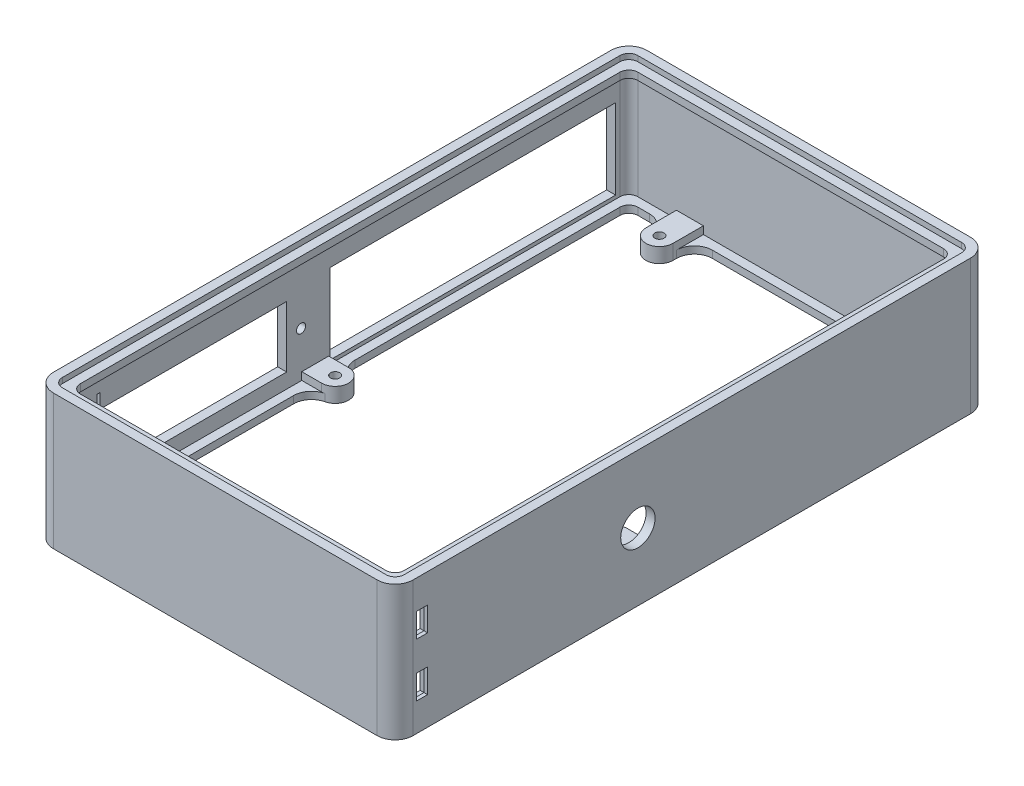
from build123d import *

# Parameters (mm, degrees)
SKETCH1_W            = 200
SKETCH1_H            = 330
BOSS_EXTRUDE1_DEPTH  = 75
FILLET1_R            = 10
CUT_EXTRUDE1_DEPTH   = 75
SKETCH3_W            = 180
SKETCH3_H            = 310
BOSS_EXTRUDE2_DEPTH  = 4
BOSS_EXTRUDE3_START  = -4
SKETCH4_W            = 180
SKETCH4_H            = 310
BOSS_EXTRUDE3_DEPTH  = 4
SKETCH8_W            = 158.75
SKETCH8_H            = 44.5
CUT_EXTRUDE2_DEPTH   = 40
BOSS_EXTRUDE4_START  = -8.23
SKETCH11_R           = 2.55
BOSS_EXTRUDE4_DEPTH  = 8.23
SKETCH12_R           = 2.55
SKETCH12_W           = 101.8
SKETCH12_H           = 34
CUT_EXTRUDE3_DEPTH   = 31.23
SKETCH13_R           = 9.55
CUT_EXTRUDE4_DEPTH   = 31.23
FILLET2_R            = 10
FILLET3_R            = 20
FILLET4_R            = 5
CUT_EXTRUDE5_DEPTH   = 10
SKETCH15_W           = 2
SKETCH15_H           = 47.02140159
BOSS_EXTRUDE5_DEPTH  = 8
SKETCH16_R           = 2.55
CUT_EXTRUDE6_DEPTH   = 2
BOSS_EXTRUDE6_START  = 3
SKETCH17_R           = 4.5
SKETCH17_R_2         = 2.55
BOSS_EXTRUDE6_DEPTH  = 3
CHAMFER1_SIZE        = 3
FILLET5_R            = 5
CHAMFER2_SIZE        = 3
SKETCH19_W           = 7
SKETCH19_H           = 14.5
CUT_EXTRUDE8_DEPTH   = 18
SKETCH22_W           = 7
SKETCH22_H           = 0.375
CUT_EXTRUDE9_DEPTH   = 18
SKETCH23_W           = 7
SKETCH23_H           = 0.375
BOSS_EXTRUDE7_DEPTH  = 5
SKETCH20_R           = 2.55
CUT_EXTRUDE10_DEPTH  = 18
SKETCH24_W           = 8
SKETCH24_H           = 15.5
CUT_EXTRUDE12_DEPTH  = 10
SKETCH25_W           = 8
SKETCH25_H           = 0.4
BOSS_EXTRUDE8_DEPTH  = 5
SKETCH26_W           = 0.1
SKETCH26_H           = 15.1
BOSS_EXTRUDE9_DEPTH  = 5
BOSS_EXTRUDE10_DEPTH = 2
SKETCH28_W           = 12.985784693
SKETCH28_H           = 10.415883014
BOSS_EXTRUDE11_DEPTH = 5
BOSS_EXTRUDE12_START = -0.6
SKETCH29_R           = 2.55
BOSS_EXTRUDE12_DEPTH = 0.6


with BuildPart() as part:
    # Sketch1 → Boss-Extrude1 (new body)
    with BuildSketch(Plane(origin=(0, 0, 0), x_dir=(1, 0, 0), z_dir=(0, 1, 0))):
        with Locations((100, 165)):
            Rectangle(SKETCH1_W, SKETCH1_H)
    extrude(amount=BOSS_EXTRUDE1_DEPTH)

    # Fillet1
    fillet1_edges = [part.edges().sort_by_distance(p)[0] for p in [
        (0, 37.5, -330),
        (200, 37.5, -330),
        (200, 37.5, 0),
        (0, 37.5, 0),
    ]]
    fillet(fillet1_edges, radius=FILLET1_R)

    # Sketch2 → Cut-Extrude1 (cut)
    with BuildSketch(Plane(origin=(0, 75, 0), x_dir=(1, 0, 0), z_dir=(0, 1, 0))):
        with BuildLine():
            Line((190, 325), (10, 325))
            ThreePointArc((10, 325), (6.464466094, 323.535533906), (5, 320))
            Line((5, 320), (5, 10))
            ThreePointArc((5, 10), (6.464466094, 6.464466094), (10, 5))
            Line((10, 5), (190, 5))
            ThreePointArc((190, 5), (193.535533906, 6.464466094), (195, 10))
            Line((195, 10), (195, 320))
            ThreePointArc((195, 320), (193.535533906, 323.535533906), (190, 325))
        make_face()
    extrude(amount=-CUT_EXTRUDE1_DEPTH, mode=Mode.SUBTRACT)

    # Sketch3 → Boss-Extrude2 (add)
    with BuildSketch(Plane(origin=(0, 72, 0), x_dir=(1, 0, 0), z_dir=(0, 1, 0))):
        with BuildLine():
            Line((10, 5), (190, 5))
            ThreePointArc((190, 5), (193.535533906, 6.464466094), (195, 10))
            Line((195, 10), (195, 320))
            ThreePointArc((195, 320), (193.535533906, 323.535533906), (190, 325))
            Line((190, 325), (10, 325))
            ThreePointArc((10, 325), (6.464466094, 323.535533906), (5, 320))
            Line((5, 320), (5, 10))
            ThreePointArc((5, 10), (6.464466094, 6.464466094), (10, 5))
        make_face()
        with Locations((100, 165)):
            Rectangle(SKETCH3_W, SKETCH3_H, mode=Mode.SUBTRACT)
    extrude(amount=-BOSS_EXTRUDE2_DEPTH)

    # Sketch4 → Boss-Extrude3 (add)
    with BuildSketch(Plane(origin=(0, 3, 0), x_dir=(-1, 0, 0), z_dir=(0, -1, 0)).offset(BOSS_EXTRUDE3_START)):
        with BuildLine():
            Line((-5, 10), (-5, 320))
            ThreePointArc((-5, 320), (-6.464466094, 323.535533906), (-10, 325))
            Line((-10, 325), (-190, 325))
            ThreePointArc((-190, 325), (-193.535533906, 323.535533906), (-195, 320))
            Line((-195, 320), (-195, 10))
            ThreePointArc((-195, 10), (-193.535533906, 6.464466094), (-190, 5))
            Line((-190, 5), (-10, 5))
            ThreePointArc((-10, 5), (-6.464466094, 6.464466094), (-5, 10))
        make_face()
        with Locations((-100, 165)):
            Rectangle(SKETCH4_W, SKETCH4_H, mode=Mode.SUBTRACT)
    extrude(amount=BOSS_EXTRUDE3_DEPTH)

    # Sketch8 → Cut-Extrude2 (cut)
    with BuildSketch(Plane(origin=(5, 0, 0), x_dir=(0, 0, -1), z_dir=(1, 0, 0))):
        with Locations((238.245, 31.25)):
            Rectangle(SKETCH8_W, SKETCH8_H)
    extrude(amount=-CUT_EXTRUDE2_DEPTH, mode=Mode.SUBTRACT)

    # Sketch11 → Boss-Extrude4 (add)
    # profile 1 of 4: a face of its own
    with BuildSketch(Plane.XZ.offset(-3).offset(BOSS_EXTRUDE4_START)):
        with BuildLine():
            Line((16.06, -158.09), (10, -158.09))
            Line((10, -158.09), (5, -158.09))
            Line((5, -158.09), (5, -143.09))
            Line((5, -143.09), (10, -143.09))
            Line((10, -143.09), (16.06, -143.09))
            ThreePointArc((16.06, -143.09), (23.56, -150.59), (16.06, -158.09))
        make_face()
        with Locations(Location((16.06, -150.59, 0), (0, 0, 270))):
            Circle(SKETCH11_R, mode=Mode.SUBTRACT)
    # profile 2 of 4: a face of its own
    with BuildSketch(Plane.XZ.offset(-3).offset(BOSS_EXTRUDE4_START)):
        with BuildLine():
            Line((31.42, -308.07), (31.42, -320))
            Line((31.42, -320), (31.42, -325))
            Line((31.42, -325), (46.42, -325))
            Line((46.42, -325), (46.42, -320))
            Line((46.42, -320), (46.42, -308.07))
            ThreePointArc((46.42, -308.07), (38.92, -300.57), (31.42, -308.07))
        make_face()
        with Locations(Location((38.92, -308.07, 0), (0, 0, 270))):
            Circle(SKETCH11_R, mode=Mode.SUBTRACT)
    # profile 3 of 4: a face of its own
    with BuildSketch(Plane.XZ.offset(-3).offset(BOSS_EXTRUDE4_START)):
        with BuildLine():
            Line((171, -300.57), (190, -300.57))
            Line((190, -300.57), (195, -300.57))
            Line((195, -300.57), (195, -320))
            ThreePointArc((195, -320), (193.535533906, -323.535533906), (190, -325))
            Line((190, -325), (163.5, -325))
            Line((163.5, -325), (163.5, -320))
            Line((163.5, -320), (163.5, -308.07))
            ThreePointArc((163.5, -308.07), (165.696699141, -302.766699141), (171, -300.57))
        make_face()
        with Locations(Location((171, -308.07, 0), (0, 0, 270))):
            Circle(SKETCH11_R, mode=Mode.SUBTRACT)
    # profile 4 of 4: a face of its own
    with BuildSketch(Plane.XZ.offset(-3).offset(BOSS_EXTRUDE4_START)):
        with BuildLine():
            Line((171, -158.09), (190, -158.09))
            Line((190, -158.09), (195, -158.09))
            Line((195, -158.09), (195, -143.09))
            Line((195, -143.09), (190, -143.09))
            Line((190, -143.09), (171, -143.09))
            ThreePointArc((171, -143.09), (163.5, -150.59), (171, -158.09))
        make_face()
        with Locations(Location((171, -150.59, 0), (0, 0, 270))):
            Circle(SKETCH11_R, mode=Mode.SUBTRACT)
    extrude(amount=BOSS_EXTRUDE4_DEPTH)

    # Sketch12 → Cut-Extrude3 (cut)
    with BuildSketch(Plane.ZY):
        with Locations((-142.7, 32.25)):
            Circle(SKETCH12_R)
        with Locations((-83.8, 32.25)):
            Rectangle(SKETCH12_W, SKETCH12_H)
    extrude(amount=-CUT_EXTRUDE3_DEPTH, mode=Mode.SUBTRACT)

    # Sketch13 → Cut-Extrude4 (cut)
    with BuildSketch(Plane.ZY.offset(-195)):
        with Locations((-135, 37.5)):
            Circle(SKETCH13_R)
    extrude(amount=-CUT_EXTRUDE4_DEPTH, mode=Mode.SUBTRACT)

    # Fillet2
    # the kernel refuses this fillet: 10 mm, written as the material it adds along each edge
    with BuildSketch(Plane(origin=(31.42, 3, -320), x_dir=(0, 0, 1), z_dir=(0, 1, 0))) as fillet2_piece_1:
        with BuildLine():
            CenterArc((FILLET2_R, -FILLET2_R), FILLET2_R, 90, 90)
            Line((0, -FILLET2_R), (0, 0))
            Line((0, 0), (FILLET2_R, 0))
        make_face()
    extrude(amount=4)
    with BuildSketch(Plane(origin=(46.42, 7, -320), x_dir=(1, 0, 0), z_dir=(0, -1, 0))) as fillet2_piece_2:
        with BuildLine():
            CenterArc((FILLET2_R, FILLET2_R), FILLET2_R, 180, 90)
            Line((0, FILLET2_R), (0, 0))
            Line((0, 0), (FILLET2_R, 0))
        make_face()
    extrude(amount=4)
    with BuildSketch(Plane(origin=(10, 7, -143.09), x_dir=(0.9996913663867205, 0, -0.02484294611859972), z_dir=(0, -1, 0))) as fillet2_piece_3:
        with BuildLine():
            CenterArc((9.759646117, 9.796182659), FILLET2_R, 181.423542417, 76.988721184)
            Line((-0.237267547, 9.547753198), (-1.236958913, 9.522910252))
            Line((-1.236958913, 9.522910252), (-0.999691366, -0.024842946))
            Line((-0.999691366, -0.024842946), (0.024842946, -0.999691366))
            ThreePointArc((0.024842946, -0.999691366), (6.082972626, -0.849143113), (7.550095388, -0.979618266))
            Line((7.550095388, -0.979618266), (7.750963636, 0))
        make_face()
    extrude(amount=4)
    with BuildSketch(Plane(origin=(10, 3, -158.09), x_dir=(0, 0, -1), z_dir=(0, 1, 0))) as fillet2_piece_4:
        with BuildLine():
            CenterArc((9.550700865, -10), FILLET2_R, 90, 76.988721184)
            Line((-0.192556772, -7.748571429), (-1.166882536, -7.523428571))
            ThreePointArc((-1.166882536, -7.523428571), (-1, -6.06), (-1, 0))
            Line((-1, 0), (0, 1))
            Line((0, 1), (9.550700865, 1))
            Line((9.550700865, 1), (9.550700865, 0))
        make_face()
    extrude(amount=4)

    # Fillet3
    # the kernel refuses this fillet: 20 mm, written as the material it adds along each edge
    with BuildSketch(Plane(origin=(190, 7, -143.09), x_dir=(-0.9999999668790588, 0, -0.00025737498219353277), z_dir=(0, -1, 0))) as fillet3_piece_1:
        with BuildLine():
            CenterArc((19.994856519, -19.986959005), FILLET3_R, 92.069195834, 87.916057665)
            Line((-0.005142819, -19.981811506), (-2.005142752, -19.981296756))
            Line((-2.005142752, -19.981296756), (-1.999999934, 0.00051475))
            Line((-1.999999934, 0.00051475), (0.00051475, 1.999999934))
            ThreePointArc((0.00051475, 1.999999934), (19.000514121, 1.995109809), (19.20051505, 1.998695901))
            Line((19.20051505, 1.998695901), (19.272727911, 0))
        make_face()
    extrude(amount=4)
    with BuildSketch(Plane(origin=(190, 3, -158.09), x_dir=(0, 0, -1), z_dir=(0, 1, 0))) as fillet3_piece_2:
        with BuildLine():
            CenterArc((19.981812167, 20), FILLET3_R, 182.083942335, 87.916057665)
            Line((-0.004960318, 19.272727273), (-2.003637567, 19.2))
            ThreePointArc((-2.003637567, 19.2), (-2, 19), (-2, 0))
            Line((-2, 0), (0, -2))
            Line((0, -2), (19.981812167, -2))
            Line((19.981812167, -2), (19.981812167, 0))
        make_face()
    extrude(amount=4)

    # Fillet4
    fillet4_edges = [part.edges().sort_by_distance(p)[0] for p in [
        (10, 5, -320),
        (10, 5, -10),
        (190, 5, -10),
        (10, 70, -10),
        (10, 70, -320),
        (190, 70, -320),
        (190, 70, -10),
    ]]
    fillet(fillet4_edges, radius=FILLET4_R)

    # Sketch14 → Cut-Extrude5 (cut)
    with BuildSketch(Plane.ZY):
        Polygon((-30.9, 49.25), (-30.9, 15.25), (-30.9, 10.25), (-29.15, 10.25), (-29.15, 57.25), (-30.9, 57.25), align=None)
    extrude(amount=-CUT_EXTRUDE5_DEPTH, mode=Mode.SUBTRACT)

    # Sketch15 → Boss-Extrude5 (add)
    with BuildSketch(Plane.ZY):
        with Locations((-31.9, 33.760700795)):
            Rectangle(SKETCH15_W, SKETCH15_H)
    extrude(amount=BOSS_EXTRUDE5_DEPTH)

    # Sketch16 → Cut-Extrude6 (cut)
    with BuildSketch(Plane(origin=(0, 0, -32.9), x_dir=(-1, 0, 0), z_dir=(0, 0, -1))):
        with Locations((0.5, 31.75)):
            Circle(SKETCH16_R)
    extrude(amount=-CUT_EXTRUDE6_DEPTH, mode=Mode.SUBTRACT)

    # Sketch17 → Boss-Extrude6 (add)
    with BuildSketch(Plane(origin=(0, 0, -32.9), x_dir=(-1, 0, 0), z_dir=(0, 0, -1)).offset(BOSS_EXTRUDE6_START)):
        with Locations((0.5, 31.75)):
            Circle(SKETCH17_R)
        with Locations((0.5, 31.75)):
            Circle(SKETCH17_R_2, mode=Mode.SUBTRACT)
    extrude(amount=-BOSS_EXTRUDE6_DEPTH)

    # Chamfer1
    # the kernel refuses this chamfer: 3 mm, written as the material it adds along each edge
    with BuildSketch(Plane(origin=(-0.5, 31.75, -32.9), x_dir=(-1, 0, 0), z_dir=(0, -1, 0))) as chamfer1_piece_1_section:
        Polygon((4.5, CHAMFER1_SIZE), (4.5 + CHAMFER1_SIZE, 0), (4.5, 0), align=None)
    chamfer1_piece_1 = revolve(axis=Axis((-0.5, 31.75, -32.9), (0, 0, -1)), mode=Mode.PRIVATE)
    chamfer1_piece_1 = split(chamfer1_piece_1, bisect_by=Plane(origin=(5, 36.059247984, -35.347606696), z_dir=(-1, 0, 0)), keep=Keep.TOP, mode=Mode.PRIVATE)
    chamfer1_piece_1 = split(chamfer1_piece_1, bisect_by=Plane(origin=(-8, 36.059247984, -35.347606696), z_dir=(1, 0, 0)), keep=Keep.TOP, mode=Mode.PRIVATE)
    chamfer1_piece_1 = split(chamfer1_piece_1, bisect_by=Plane(origin=(-2.987945483, 36.059247984, -35.9), z_dir=(0, 0, 1)), keep=Keep.TOP, mode=Mode.PRIVATE)
    add(chamfer1_piece_1)

    # Fillet5
    fillet5_edges = [part.edges().sort_by_distance(p)[0] for p in [
        (-8, 57.27140159, -31.9),
        (-8, 10.25, -31.9),
    ]]
    fillet(fillet5_edges, radius=FILLET5_R)

    # Chamfer2
    chamfer2_edges = [part.edges().sort_by_distance(p)[0] for p in [
        (0, 53.260700795, -32.9),
        (0, 12.75, -32.9),
    ]]
    chamfer(chamfer2_edges, length=CHAMFER2_SIZE)

    # Sketch19 → Cut-Extrude8 (cut)
    with BuildSketch(Plane(origin=(200, 0, 0), x_dir=(0, 0, -1), z_dir=(1, 0, 0))):
        with Locations((15, 52)):
            Rectangle(SKETCH19_W, SKETCH19_H)
        with Locations((15, 22.25)):
            Rectangle(SKETCH19_W, SKETCH19_H)
    extrude(amount=-CUT_EXTRUDE8_DEPTH, mode=Mode.SUBTRACT)

    # Sketch22 → Cut-Extrude9 (cut)
    with BuildSketch(Plane(origin=(200, 0, 0), x_dir=(0, 0, -1), z_dir=(1, 0, 0))):
        with Locations((15, 59.4375)):
            Rectangle(SKETCH22_W, SKETCH22_H)
        with Locations((15, 29.6875)):
            Rectangle(SKETCH22_W, SKETCH22_H)
    extrude(amount=-CUT_EXTRUDE9_DEPTH, mode=Mode.SUBTRACT)

    # Sketch23 → Boss-Extrude7 (add)
    with BuildSketch(Plane(origin=(200, 0, 0), x_dir=(0, 0, -1), z_dir=(1, 0, 0))):
        with Locations((15, 44.9375)):
            Rectangle(SKETCH23_W, SKETCH23_H)
        with Locations((15, 15.1875)):
            Rectangle(SKETCH23_W, SKETCH23_H)
    extrude(amount=-BOSS_EXTRUDE7_DEPTH)

    # Sketch20 → Cut-Extrude10 (cut)
    with BuildSketch(Plane(origin=(0, 0, -5), x_dir=(-1, 0, 0), z_dir=(0, 0, -1))):
        with Locations((-178, 37.125)):
            Circle(SKETCH20_R)
        with Locations((-168, 62.125)):
            Circle(SKETCH20_R)
        with Locations((-168, 12.125)):
            Circle(SKETCH20_R)
    extrude(amount=-CUT_EXTRUDE10_DEPTH, mode=Mode.SUBTRACT)

    # Sketch24 → Cut-Extrude12 (cut)
    with BuildSketch(Plane(origin=(200, 0, 0), x_dir=(0, 0, -1), z_dir=(1, 0, 0))):
        with Locations((15, 22.625)):
            Rectangle(SKETCH24_W, SKETCH24_H)
        with Locations((15, 52.375)):
            Rectangle(SKETCH24_W, SKETCH24_H)
    extrude(amount=-CUT_EXTRUDE12_DEPTH, mode=Mode.SUBTRACT)

    # Sketch25 → Boss-Extrude8 (add)
    with BuildSketch(Plane(origin=(200, 0, 0), x_dir=(0, 0, -1), z_dir=(1, 0, 0))):
        with Locations((15, 59.925)):
            Rectangle(SKETCH25_W, SKETCH25_H)
        with Locations((15, 30.175)):
            Rectangle(SKETCH25_W, SKETCH25_H)
    extrude(amount=-BOSS_EXTRUDE8_DEPTH)

    # Sketch26 → Boss-Extrude9 (add)
    with BuildSketch(Plane(origin=(200, 0, 0), x_dir=(0, 0, -1), z_dir=(1, 0, 0))):
        with Locations((11.05, 52.175)):
            Rectangle(SKETCH26_W, SKETCH26_H)
        with Locations((18.95, 52.175)):
            Rectangle(SKETCH26_W, SKETCH26_H)
        with Locations((18.95, 22.425)):
            Rectangle(SKETCH26_W, SKETCH26_H)
        with Locations((11.05, 22.425)):
            Rectangle(SKETCH26_W, SKETCH26_H)
    extrude(amount=-BOSS_EXTRUDE9_DEPTH)

    # Sketch27 → Boss-Extrude10 (add)
    with BuildSketch(Plane(origin=(200, 0, 0), x_dir=(0, 0, -1), z_dir=(1, 0, 0))):
        Polygon((18.05, 22.425), (18.9, 22.425), (18.9, 29.975), (11.1, 29.975), (11.1, 22.425), (11.95, 22.425), (11.95, 29.125), (15, 29.125), (18.05, 29.125), align=None)
        Polygon((18.9, 14.875), (18.9, 22.425), (18.05, 22.425), (18.05, 15.725), (11.95, 15.725), (11.95, 22.425), (11.1, 22.425), (11.1, 14.875), align=None)
        Polygon((18.9, 44.625), (18.9, 52.175), (18.05, 52.175), (18.05, 45.475), (11.95, 45.475), (11.95, 52.175), (11.1, 52.175), (11.1, 44.625), align=None)
        Polygon((18.05, 52.175), (18.9, 52.175), (18.9, 59.725), (11.1, 59.725), (11.1, 52.175), (11.95, 52.175), (11.95, 58.875), (15, 58.875), (18.05, 58.875), align=None)
    extrude(amount=-BOSS_EXTRUDE10_DEPTH)

    # Sketch28 → Boss-Extrude11 (add)
    with BuildSketch(Plane(origin=(0, 0, -5), x_dir=(-1, 0, 0), z_dir=(0, 0, -1))):
        with Locations((-176.768468334, 36.353971187)):
            Rectangle(SKETCH28_W, SKETCH28_H)
    extrude(amount=-BOSS_EXTRUDE11_DEPTH)

    # Sketch29 → Boss-Extrude12 (add)
    with BuildSketch(Plane.XY.offset(BOSS_EXTRUDE12_START)):
        with Locations(Location((168, 62.125, 0), (0, 0, 180))):
            Circle(SKETCH29_R)
        with Locations(Location((168, 12.125, 0), (0, 0, 180))):
            Circle(SKETCH29_R)
    extrude(amount=BOSS_EXTRUDE12_DEPTH)


solid = part.part
